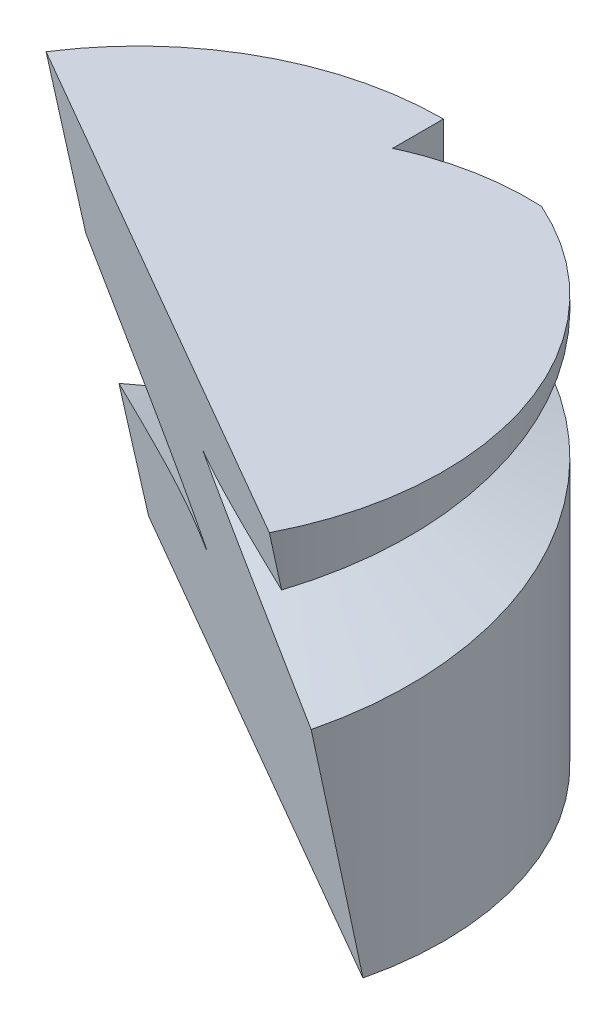
from build123d import *

# Parameters (mm, degrees)
SKETCH_2_R              = 12
EXTRUDE_1_DEPTH         = 8
SWEEP_3_PITCH           = 8
SURFACE_START           = -14
SURFACE_CUT_2_OUTLINE_W = 28
SURFACE_CUT_2_OUTLINE_H = 22
SURFACE_CUT_2_DEPTH     = 15.943319485


with BuildPart() as part:
    # Эскиз2 → Бобышка-Вытянуть1 (new, symmetric)
    with BuildSketch(Plane(origin=(0, 0, 0), x_dir=(1, 0, 0), z_dir=(0, 1, 0))):
        with Locations(Location((0, 0, 0), (0, 0, 270))):
            Circle(SKETCH_2_R)
    extrude(amount=EXTRUDE_1_DEPTH, both=True)

    # Вырез-По траектории3: arcs per turn and ends read off the stored shape
    # Вырез-По траектории3: the profile of Эскиз5<2> screwed along a right-hand helix through 1 turns, 14 arcs to a turn; built about Z, then put on its axis
    sweep_3_z = Axis((0, 0, 0), (0, 0, 1))
    sweep_3_corners = [(17.464, 0, 2), (2.536, 0, 5.999945545), (17.464, 0, 9.999891089)]
    with BuildLine(mode=Mode.PRIVATE) as sweep_3_profile:
        Line(sweep_3_corners[0], sweep_3_corners[1])
        Line(sweep_3_corners[1], sweep_3_corners[2])
        Line(sweep_3_corners[2], sweep_3_corners[0])
    sweep_3_cap = Face(sweep_3_profile.wire())
    sweep_3_turn_angles = [0, 12.857142857, 25.714285714, 38.571428571, 51.428571429, 64.285714286, 77.142857143, 90, 102.857142857, 115.714285714, 128.571428571, 141.428571429, 154.285714286, 167.142857143, 180, 192.857142857, 205.714285714, 218.571428571, 231.428571429, 244.285714286, 257.142857143, 270, 282.857142857, 295.714285714, 308.571428571, 321.428571429, 334.285714286, 347.142857143, 360]
    sweep_3_turn_weights = [1, 0.9749279121818236, 1, 0.9749279121818236, 1, 0.9749279121818236, 1, 0.9749279121818236, 1, 0.9749279121818236, 1, 0.9749279121818236, 1, 0.9749279121818236, 1, 0.9749279121818236, 1, 0.9749279121818236, 1, 0.9749279121818236, 1, 0.9749279121818236, 1, 0.9749279121818237, 1, 0.9749279121818236, 1, 0.9749279121818236, 1]
    sweep_3_turn_rails = [Edge.make_bspline([Vector(p[0], p[1], 0).rotate(sweep_3_z, sweep_3_turn_angles[k]) / sweep_3_turn_weights[k] + Vector(0, 0, p[2] + SWEEP_3_PITCH * sweep_3_turn_angles[k] / 360) for k in range(29)], [0, 0, 0, 1, 1, 2, 2, 3, 3, 4, 4, 5, 5, 6, 6, 7, 7, 8, 8, 9, 9, 10, 10, 11, 11, 12, 12, 13, 13, 14, 14, 14], 2, sweep_3_turn_weights) for p in sweep_3_corners]
    sweep_3_turn_sides = [Face.make_surface_from_curves(sweep_3_turn_rails[p[0]], sweep_3_turn_rails[p[1]]) for p in [(0, 1), (1, 2), (2, 0)]]
    sweep_3 = Plane(origin=(0, -8, 0), x_dir=(0, 0, -1), z_dir=(0, 1, 0)) * Solid(Shell([*sweep_3_turn_sides, sweep_3_cap, sweep_3_cap.rotate(sweep_3_z, 360).moved(Location((0, 0, SWEEP_3_PITCH * 360 / 360)))]))
    add(sweep_3, mode=Mode.SUBTRACT)

    # Surface Cut 2: read off the stored shape, not the designer's step
    # Surface Cut 2 outline → Surface Cut 2 (cut)
    with BuildSketch(Plane(origin=(0, 0, 0), x_dir=(0.8703668320896428, -0.09824022777399519, 0.48250433702211726), z_dir=(0.4924038765061049, 0.17364817766692997, -0.8528685319524428)).offset(SURFACE_START)):
        Rectangle(SURFACE_CUT_2_OUTLINE_W, SURFACE_CUT_2_OUTLINE_H)
    extrude(amount=SURFACE_CUT_2_DEPTH, mode=Mode.SUBTRACT)


solid = part.part
